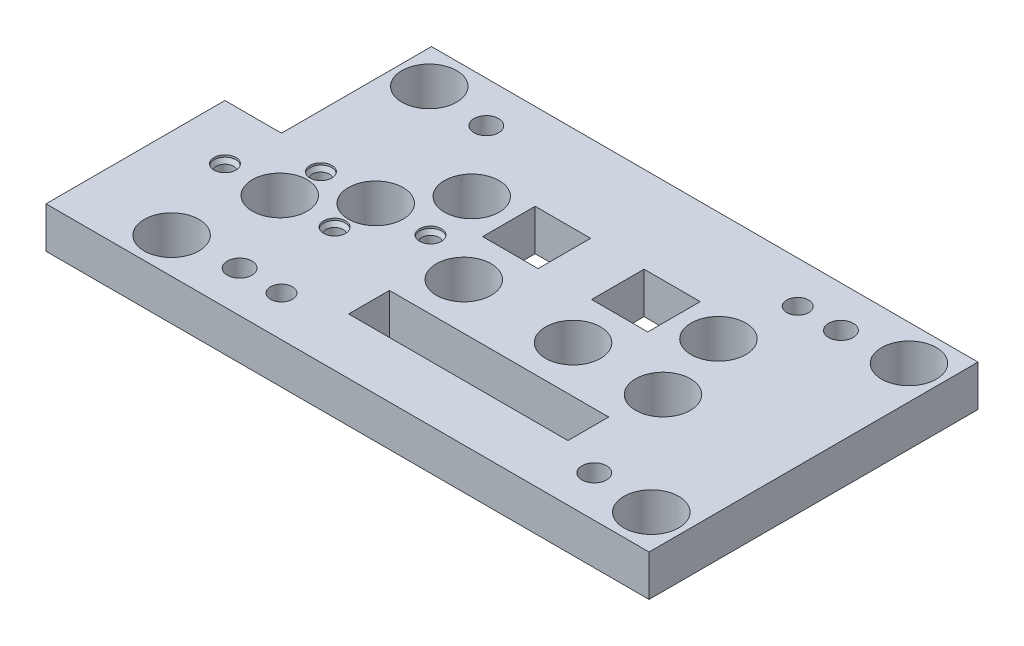
from build123d import *

# Parameters (mm, degrees)
SKETCH1_W                                           = 220
SKETCH1_H                                           = 120
BOSS_EXTRUDE1_DEPTH                                 = 15
CUT_EXTRUDE1_REACH                                  = 128.194
SKETCH2_W                                           = 20.632503002
SKETCH2_H                                           = 54.730004003
CUT_EXTRUDE2_REACH                                  = 128.194
SKETCH3_W                                           = 20.25
SKETCH3_H                                           = 19.16
SKETCH3_W_2                                         = 20.5
CUT_EXTRUDE3_REACH                                  = 128.194
SKETCH4_W                                           = 80
SKETCH4_H                                           = 14.88
F_6_2_6_2_DIAMETER_HOLE1_D                          = 6.2
SKETCH8_R                                           = 4
CUT_EXTRUDE4_DEPTH                                  = 0.5
CHAMFER1_SIZE                                       = 1.8
CHAMFER1_SIZE_2                                     = 1.039230485
CUT_EXTRUDE5_REACH                                  = 128.194
SKETCH9_R                                           = 10
CBORE_FOR_M8_HEX_SOCKET_HEAD_CAP_SCREW1_D           = 9
CBORE_FOR_M8_HEX_SOCKET_HEAD_CAP_SCREW1_CBORE_D     = 15
CBORE_FOR_M8_HEX_SOCKET_HEAD_CAP_SCREW1_CBORE_DEPTH = 8.6
F_8_0MM_DOWEL_HOLE1_D                               = 8


with BuildPart() as part:
    # Sketch1 → Boss-Extrude1 (new body)
    with BuildSketch(Plane(origin=(0, 0, 0), x_dir=(1, 0, 0), z_dir=(0, 1, 0))):
        Rectangle(SKETCH1_W, SKETCH1_H)
    extrude(amount=-BOSS_EXTRUDE1_DEPTH)

    # Sketch2 → Cut-Extrude1 (cut, up to next)
    with BuildSketch(Plane(origin=(0, 0, 0), x_dir=(1, 0, 0), z_dir=(0, 1, 0)), mode=Mode.PRIVATE) as cut_extrude1_sk1:
        with Locations((-99.683748499, 32.634997999)):
            Rectangle(SKETCH2_W, SKETCH2_H)
    cut_extrude1_tool1 = extrude(cut_extrude1_sk1.sketch, amount=-CUT_EXTRUDE1_REACH, mode=Mode.PRIVATE) & part.part
    add(cut_extrude1_tool1.solids().sort_by_distance((-99.683748, 0, -32.634998))[0], mode=Mode.SUBTRACT)

    # Sketch3 → Cut-Extrude2 (cut, up to next)
    with BuildSketch(Plane(origin=(0, 0, 0), x_dir=(1, 0, 0), z_dir=(0, 1, 0)), mode=Mode.PRIVATE) as cut_extrude2_sk1:
        with Locations((-9.875, 18.86)):
            Rectangle(SKETCH3_W, SKETCH3_H)
    cut_extrude2_tool1 = extrude(cut_extrude2_sk1.sketch, amount=-CUT_EXTRUDE2_REACH, mode=Mode.PRIVATE) & part.part
    # Sketch3 → Cut-Extrude2 (cut, up to next)
    with BuildSketch(Plane(origin=(0, 0, 0), x_dir=(1, 0, 0), z_dir=(0, 1, 0)), mode=Mode.PRIVATE) as cut_extrude2_sk2:
        with Locations((30, 18.86)):
            Rectangle(SKETCH3_W_2, SKETCH3_H)
    cut_extrude2_tool2 = extrude(cut_extrude2_sk2.sketch, amount=-CUT_EXTRUDE2_REACH, mode=Mode.PRIVATE) & part.part
    add(cut_extrude2_tool1.solids().sort_by_distance((-9.875, 0, -18.86))[0], mode=Mode.SUBTRACT)
    add(cut_extrude2_tool2.solids().sort_by_distance((30, 0, -18.86))[0], mode=Mode.SUBTRACT)

    # Sketch4 → Cut-Extrude3 (cut, up to next)
    with BuildSketch(Plane(origin=(0, 0, 0), x_dir=(1, 0, 0), z_dir=(0, 1, 0)), mode=Mode.PRIVATE) as cut_extrude3_sk1:
        with Locations((20, -32.16)):
            Rectangle(SKETCH4_W, SKETCH4_H)
    cut_extrude3_tool1 = extrude(cut_extrude3_sk1.sketch, amount=-CUT_EXTRUDE3_REACH, mode=Mode.PRIVATE) & part.part
    add(cut_extrude3_tool1.solids().sort_by_distance((20, 0, 32.16))[0], mode=Mode.SUBTRACT)

    # Ø6.2 (6.2) Diameter Hole1 (through all)
    with Locations(Plane(origin=(0, 0, 0), x_dir=(1, 0, 0), z_dir=(0, 1, 0))):
        with Locations((-30, 0.28), (-50, -14.72), (-70, 0.28), (-90, -14.72)):
            Hole(F_6_2_6_2_DIAMETER_HOLE1_D / 2)

    # Sketch8 → Cut-Extrude4 (cut)
    with BuildSketch(Plane(origin=(0, 0, 0), x_dir=(1, 0, 0), z_dir=(0, 1, 0))):
        with Locations(Location((-90, -14.72, 0), (0, 0, 270))):
            Circle(SKETCH8_R)
        with Locations(Location((-70, 0.28, 0), (0, 0, 270))):
            Circle(SKETCH8_R)
        with Locations(Location((-50, -14.72, 0), (0, 0, 270))):
            Circle(SKETCH8_R)
        with Locations(Location((-30, 0.28, 0), (0, 0, 270))):
            Circle(SKETCH8_R)
    extrude(amount=-CUT_EXTRUDE4_DEPTH, mode=Mode.SUBTRACT)

    # Chamfer1
    # the kernel refuses this chamfer: 1.8, 1.039230485 mm, written as the material it takes off along each edge
    with BuildSketch(Plane(origin=(-90, -0.5, 14.72), x_dir=(-1, 0, 0), z_dir=(0, 0, 1))) as chamfer1_piece_1_section:
        Polygon((3.1, CHAMFER1_SIZE), (3.1 + CHAMFER1_SIZE_2, 0), (3.1, 0), align=None)
    chamfer1_piece_1 = revolve(axis=Axis((-90, -0.5, 14.72), (0, -1, 0)), mode=Mode.PRIVATE)
    chamfer1_piece_1 = chamfer1_piece_1 & Plane(origin=(-90, -1.537716701, 14.72), x_dir=(0, 0, 1), z_dir=(0, 1, 0)) * Cylinder(4, 17, mode=Mode.PRIVATE)
    add(chamfer1_piece_1, mode=Mode.SUBTRACT)
    with BuildSketch(Plane(origin=(-30, -0.5, -0.28), x_dir=(-1, 0, 0), z_dir=(0, 0, 1))) as chamfer1_piece_2_section:
        Polygon((3.1, CHAMFER1_SIZE), (3.1 + CHAMFER1_SIZE_2, 0), (3.1, 0), align=None)
    chamfer1_piece_2 = revolve(axis=Axis((-30, -0.5, -0.28), (0, -1, 0)), mode=Mode.PRIVATE)
    chamfer1_piece_2 = chamfer1_piece_2 & Plane(origin=(-30, -1.537716701, -0.28), x_dir=(0, 0, 1), z_dir=(0, 1, 0)) * Cylinder(4, 17, mode=Mode.PRIVATE)
    add(chamfer1_piece_2, mode=Mode.SUBTRACT)
    with BuildSketch(Plane(origin=(-50, -0.5, 14.72), x_dir=(-1, 0, 0), z_dir=(0, 0, 1))) as chamfer1_piece_3_section:
        Polygon((3.1, CHAMFER1_SIZE), (3.1 + CHAMFER1_SIZE_2, 0), (3.1, 0), align=None)
    chamfer1_piece_3 = revolve(axis=Axis((-50, -0.5, 14.72), (0, -1, 0)), mode=Mode.PRIVATE)
    chamfer1_piece_3 = chamfer1_piece_3 & Plane(origin=(-50, -1.537716701, 14.72), x_dir=(0, 0, 1), z_dir=(0, 1, 0)) * Cylinder(4, 17, mode=Mode.PRIVATE)
    add(chamfer1_piece_3, mode=Mode.SUBTRACT)
    with BuildSketch(Plane(origin=(-70, -0.5, -0.28), x_dir=(-1, 0, 0), z_dir=(0, 0, 1))) as chamfer1_piece_4_section:
        Polygon((3.1, CHAMFER1_SIZE), (3.1 + CHAMFER1_SIZE_2, 0), (3.1, 0), align=None)
    chamfer1_piece_4 = revolve(axis=Axis((-70, -0.5, -0.28), (0, -1, 0)), mode=Mode.PRIVATE)
    chamfer1_piece_4 = chamfer1_piece_4 & Plane(origin=(-70, -1.537716701, -0.28), x_dir=(0, 0, 1), z_dir=(0, 1, 0)) * Cylinder(4, 17, mode=Mode.PRIVATE)
    add(chamfer1_piece_4, mode=Mode.SUBTRACT)

    # Sketch9 → Cut-Extrude5 (cut, up to next)
    with BuildSketch(Plane(origin=(0, 0, 0), x_dir=(1, 0, 0), z_dir=(0, 1, 0)), mode=Mode.PRIVATE) as cut_extrude5_sk1:
        with Locations(Location((-77.183748499, -47, 0), (0, 0, 270))):
            Circle(SKETCH9_R)
    cut_extrude5_tool1 = extrude(cut_extrude5_sk1.sketch, amount=-CUT_EXTRUDE5_REACH, mode=Mode.PRIVATE) & part.part
    # Sketch9 → Cut-Extrude5 (cut, up to next)
    with BuildSketch(Plane(origin=(0, 0, 0), x_dir=(1, 0, 0), z_dir=(0, 1, 0)), mode=Mode.PRIVATE) as cut_extrude5_sk2:
        with Locations(Location((97.816251501, -47, 0), (0, 0, 270))):
            Circle(SKETCH9_R)
    cut_extrude5_tool2 = extrude(cut_extrude5_sk2.sketch, amount=-CUT_EXTRUDE5_REACH, mode=Mode.PRIVATE) & part.part
    # Sketch9 → Cut-Extrude5 (cut, up to next)
    with BuildSketch(Plane(origin=(0, 0, 0), x_dir=(1, 0, 0), z_dir=(0, 1, 0)), mode=Mode.PRIVATE) as cut_extrude5_sk3:
        with Locations(Location((62.816251501, -7.72, 0), (0, 0, 270))):
            Circle(SKETCH9_R)
    cut_extrude5_tool3 = extrude(cut_extrude5_sk3.sketch, amount=-CUT_EXTRUDE5_REACH, mode=Mode.PRIVATE) & part.part
    # Sketch9 → Cut-Extrude5 (cut, up to next)
    with BuildSketch(Plane(origin=(0, 0, 0), x_dir=(1, 0, 0), z_dir=(0, 1, 0)), mode=Mode.PRIVATE) as cut_extrude5_sk4:
        with Locations(Location((30, -7.72, 0), (0, 0, 270))):
            Circle(SKETCH9_R)
    cut_extrude5_tool4 = extrude(cut_extrude5_sk4.sketch, amount=-CUT_EXTRUDE5_REACH, mode=Mode.PRIVATE) & part.part
    # Sketch9 → Cut-Extrude5 (cut, up to next)
    with BuildSketch(Plane(origin=(0, 0, 0), x_dir=(1, 0, 0), z_dir=(0, 1, 0)), mode=Mode.PRIVATE) as cut_extrude5_sk5:
        with Locations(Location((-9.875, -7.72, 0), (0, 0, 270))):
            Circle(SKETCH9_R)
    cut_extrude5_tool5 = extrude(cut_extrude5_sk5.sketch, amount=-CUT_EXTRUDE5_REACH, mode=Mode.PRIVATE) & part.part
    # Sketch9 → Cut-Extrude5 (cut, up to next)
    with BuildSketch(Plane(origin=(0, 0, 0), x_dir=(1, 0, 0), z_dir=(0, 1, 0)), mode=Mode.PRIVATE) as cut_extrude5_sk6:
        with Locations(Location((-70, -14.72, 0), (0, 0, 270))):
            Circle(SKETCH9_R)
    cut_extrude5_tool6 = extrude(cut_extrude5_sk6.sketch, amount=-CUT_EXTRUDE5_REACH, mode=Mode.PRIVATE) & part.part
    # Sketch9 → Cut-Extrude5 (cut, up to next)
    with BuildSketch(Plane(origin=(0, 0, 0), x_dir=(1, 0, 0), z_dir=(0, 1, 0)), mode=Mode.PRIVATE) as cut_extrude5_sk7:
        with Locations(Location((-50, 0.28, 0), (0, 0, 270))):
            Circle(SKETCH9_R)
    cut_extrude5_tool7 = extrude(cut_extrude5_sk7.sketch, amount=-CUT_EXTRUDE5_REACH, mode=Mode.PRIVATE) & part.part
    # Sketch9 → Cut-Extrude5 (cut, up to next)
    with BuildSketch(Plane(origin=(0, 0, 0), x_dir=(1, 0, 0), z_dir=(0, 1, 0)), mode=Mode.PRIVATE) as cut_extrude5_sk8:
        with Locations(Location((55.316251501, 20, 0), (0, 0, 270))):
            Circle(SKETCH9_R)
    cut_extrude5_tool8 = extrude(cut_extrude5_sk8.sketch, amount=-CUT_EXTRUDE5_REACH, mode=Mode.PRIVATE) & part.part
    # Sketch9 → Cut-Extrude5 (cut, up to next)
    with BuildSketch(Plane(origin=(0, 0, 0), x_dir=(1, 0, 0), z_dir=(0, 1, 0)), mode=Mode.PRIVATE) as cut_extrude5_sk9:
        with Locations(Location((97.816251501, 47, 0), (0, 0, 270))):
            Circle(SKETCH9_R)
    cut_extrude5_tool9 = extrude(cut_extrude5_sk9.sketch, amount=-CUT_EXTRUDE5_REACH, mode=Mode.PRIVATE) & part.part
    # Sketch9 → Cut-Extrude5 (cut, up to next)
    with BuildSketch(Plane(origin=(0, 0, 0), x_dir=(1, 0, 0), z_dir=(0, 1, 0)), mode=Mode.PRIVATE) as cut_extrude5_sk10:
        with Locations(Location((-34.683748499, 20, 0), (0, 0, 270))):
            Circle(SKETCH9_R)
    cut_extrude5_tool10 = extrude(cut_extrude5_sk10.sketch, amount=-CUT_EXTRUDE5_REACH, mode=Mode.PRIVATE) & part.part
    # Sketch9 → Cut-Extrude5 (cut, up to next)
    with BuildSketch(Plane(origin=(0, 0, 0), x_dir=(1, 0, 0), z_dir=(0, 1, 0)), mode=Mode.PRIVATE) as cut_extrude5_sk11:
        with Locations(Location((-77.183748499, 47, 0), (0, 0, 270))):
            Circle(SKETCH9_R)
    cut_extrude5_tool11 = extrude(cut_extrude5_sk11.sketch, amount=-CUT_EXTRUDE5_REACH, mode=Mode.PRIVATE) & part.part
    add(cut_extrude5_tool1.solids().sort_by_distance((-77.183748, 0, 47))[0], mode=Mode.SUBTRACT)
    add(cut_extrude5_tool2.solids().sort_by_distance((97.816252, 0, 47))[0], mode=Mode.SUBTRACT)
    add(cut_extrude5_tool3.solids().sort_by_distance((62.816252, 0, 7.72))[0], mode=Mode.SUBTRACT)
    add(cut_extrude5_tool4.solids().sort_by_distance((30, 0, 7.72))[0], mode=Mode.SUBTRACT)
    add(cut_extrude5_tool5.solids().sort_by_distance((-9.875, 0, 7.72))[0], mode=Mode.SUBTRACT)
    add(cut_extrude5_tool6.solids().sort_by_distance((-70, 0, 14.72))[0], mode=Mode.SUBTRACT)
    add(cut_extrude5_tool7.solids().sort_by_distance((-50, 0, -0.28))[0], mode=Mode.SUBTRACT)
    add(cut_extrude5_tool8.solids().sort_by_distance((55.316252, 0, -20))[0], mode=Mode.SUBTRACT)
    add(cut_extrude5_tool9.solids().sort_by_distance((97.816252, 0, -47))[0], mode=Mode.SUBTRACT)
    add(cut_extrude5_tool10.solids().sort_by_distance((-34.683748, 0, -20))[0], mode=Mode.SUBTRACT)
    add(cut_extrude5_tool11.solids().sort_by_distance((-77.183748, 0, -47))[0], mode=Mode.SUBTRACT)

    # CBORE for M8 Hex Socket Head Cap Screw1 (through all)
    with Locations(Plane(origin=(0, -15, 0), x_dir=(-1, 0, 0), z_dir=(0, -1, 0))):
        with Locations((-75, 45), (54.367496998, 45), (54.367496998, -45), (-75, -45)):
            CounterBoreHole(CBORE_FOR_M8_HEX_SOCKET_HEAD_CAP_SCREW1_D / 2, CBORE_FOR_M8_HEX_SOCKET_HEAD_CAP_SCREW1_CBORE_D / 2, CBORE_FOR_M8_HEX_SOCKET_HEAD_CAP_SCREW1_CBORE_DEPTH)

    # Ø8.0mm Dowel Hole1 (through all)
    with Locations(Plane(origin=(0, -15, 0), x_dir=(-1, 0, 0), z_dir=(0, -1, 0))):
        with Locations((-59.5, 44.728378806), (38.867496998, -45.241024981)):
            Hole(F_8_0MM_DOWEL_HOLE1_D / 2)


solid = part.part
